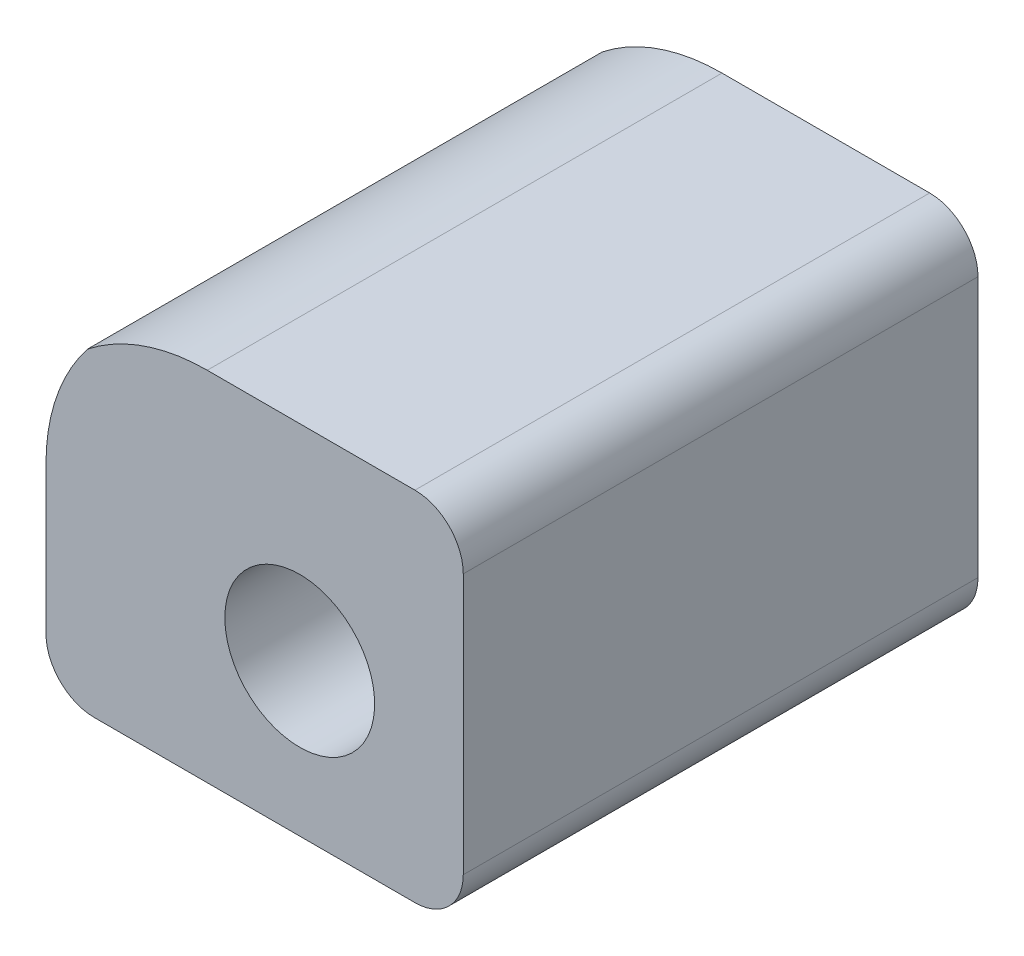
from build123d import *

# Parameters (mm, degrees)
SKETCH_1_R          = 1.531489915
EXTRUDE_1_DEPTH     = 1.68
SKETCH_1_R_2        = 1.063949022
EXTRUDE_1_2_DEPTH   = 1.68
SKETCH_1_R_3        = 2.489250022
EXTRUDE_1_3_DEPTH   = 1.68
SKETCH_1_W          = 72.86
SKETCH_1_H          = 61.86
SKETCH_1_R_4        = 1.55
EXTRUDE_1_4_DEPTH   = 1.68
SKETCH_2_R          = 3
SKETCH_2_R_2        = 1.55
EXTRUDE_3_DEPTH     = 2
SKETCH_3_W          = 72.86
SKETCH_3_H          = 61.86
SKETCH_3_W_2        = 69.50125591
SKETCH_3_H_2        = 58.5
EXTRUDE_4_DEPTH     = 15.85
SKETCH_4_W          = 17
SKETCH_4_H          = 15
CUT_EXTRUDE_1_DEPTH = 3.68
SKETCH_6_W          = 7.25
SKETCH_6_H          = 16
SKETCH_6_W_2        = 2.5
SKETCH_6_H_2        = 18
CUT_EXTRUDE_3_DEPTH = 7.8
SKETCH_7_W          = 10
SKETCH_7_H          = 4
SKETCH_7_W_2        = 17
SKETCH_7_H_2        = 8
SKETCH_7_W_3        = 8
SKETCH_7_H_3        = 13.300256909
CUT_EXTRUDE_5_DEPTH = 2
SKETCH_8_R          = 1.556852558
SKETCH_8_W          = 2.041099746
SKETCH_8_H          = 24.945353107
CUT_EXTRUDE_6_DEPTH = 2
FILLET_1_R          = 1.68
FILLET_2_R          = 2
FILLET_3_R          = 1.68
FILLET_4_R          = 2
FILLET_5_R          = 3
FILLET_6_R          = 1
FILLET_7_R          = 1
SKETCH_9_R          = 4
CUT_EXTRUDE_7_DEPTH = 0.8
SKETCH_10_W         = 44.758598589
SKETCH_10_H         = 6.5
SKETCH_10_W_2       = 44.448850503
CUT_EXTRUDE_8_DEPTH = 0.8
SKETCH_11_R         = 1.55
EXTRUDE_6_DEPTH     = 10.65
CUT_EXTRUDE_9_DEPTH = 62.6
FILLET_8_R          = 4
FILLET_9_R          = 1


with BuildPart() as part:
    # 草图1 → 凸台-拉伸1 (new body)
    with BuildSketch(Plane.XY):
        with Locations((1.504266973, 51.672660554)):
            Circle(SKETCH_1_R)
    extrude(amount=EXTRUDE_1_DEPTH)


with BuildPart() as body_2:
    # 草图1 → Extrude 1 2 (new body)
    with BuildSketch(Plane.XY):
        with Locations((-18.258772408, 61.840992468)):
            Circle(SKETCH_1_R_2)
    extrude(amount=EXTRUDE_1_2_DEPTH)


with BuildPart() as body_3:
    # 草图1 → Extrude 1 3 (new body)
    with BuildSketch(Plane.XY):
        with Locations((-18.258772408, -10.975845657)):
            Circle(SKETCH_1_R_3)
    extrude(amount=EXTRUDE_1_3_DEPTH)


with BuildPart() as body_4:
    # 草图1 → Extrude 1 4 (new body)
    with BuildSketch(Plane.XY):
        with Locations((-46.758772408, 26.672660554)):
            Rectangle(SKETCH_1_W, SKETCH_1_H)
        with Locations((-76.258772408, 51.672660554)):
            Circle(SKETCH_1_R_4, mode=Mode.SUBTRACT)
        with Locations((-18.258772408, 51.672660554)):
            Circle(SKETCH_1_R_4, mode=Mode.SUBTRACT)
        with Locations((-76.258772408, 2.672660554)):
            Circle(SKETCH_1_R_4, mode=Mode.SUBTRACT)
        with Locations((-18.258772408, 2.672660554)):
            Circle(SKETCH_1_R_4, mode=Mode.SUBTRACT)
    extrude(amount=EXTRUDE_1_4_DEPTH)

    # 草图2 → 凸台-拉伸3 (add)
    # profile 1 of 4: a face of its own
    with BuildSketch(Plane.XY.offset(1.68)):
        with Locations((-76.258772408, 2.672660554)):
            Circle(SKETCH_2_R)
        with Locations((-76.258772408, 2.672660554)):
            Circle(SKETCH_2_R_2, mode=Mode.SUBTRACT)
    # profile 2 of 4: a face of its own
    with BuildSketch(Plane.XY.offset(1.68)):
        with Locations((-18.258772408, 2.672660554)):
            Circle(SKETCH_2_R)
        with Locations((-18.258772408, 2.672660554)):
            Circle(SKETCH_2_R_2, mode=Mode.SUBTRACT)
    # profile 3 of 4: a face of its own
    with BuildSketch(Plane.XY.offset(1.68)):
        with Locations((-76.258772408, 51.672660554)):
            Circle(SKETCH_2_R)
        with Locations((-76.258772408, 51.672660554)):
            Circle(SKETCH_2_R_2, mode=Mode.SUBTRACT)
    # profile 4 of 4: a face of its own
    with BuildSketch(Plane.XY.offset(1.68)):
        with Locations((-18.258772408, 51.672660554)):
            Circle(SKETCH_2_R)
        with Locations((-18.258772408, 51.672660554)):
            Circle(SKETCH_2_R_2, mode=Mode.SUBTRACT)
    extrude(amount=EXTRUDE_3_DEPTH)

    # 草图3 → 凸台-拉伸4 (add)
    with BuildSketch(Plane.XY.offset(1.68)):
        with Locations((-46.758772408, 26.672660554)):
            Rectangle(SKETCH_3_W, SKETCH_3_H)
        with Locations((-46.758144453, 26.672660554)):
            Rectangle(SKETCH_3_W_2, SKETCH_3_H_2, mode=Mode.SUBTRACT)
    extrude(amount=EXTRUDE_4_DEPTH)

    # 草图4 → 切除-拉伸1 (cut)
    with BuildSketch(Plane(origin=(0, 0, 0), x_dir=(-1, 0, 0), z_dir=(0, 0, -1))):
        with Locations((74.688772408, 28.322197805)):
            Rectangle(SKETCH_4_W, SKETCH_4_H)
    extrude(amount=-CUT_EXTRUDE_1_DEPTH, mode=Mode.SUBTRACT)

    # 草图6 → 切除-拉伸3 (cut)
    with BuildSketch(Plane(origin=(-10.328772408, 0, 0), x_dir=(0, 0, -1), z_dir=(1, 0, 0))):
        with Locations((-8.625, 30.672660554)):
            Rectangle(SKETCH_6_W, SKETCH_6_H)
        with Locations((-14.975303343, 19.628822862)):
            Rectangle(SKETCH_6_W_2, SKETCH_6_H_2)
    extrude(amount=-CUT_EXTRUDE_3_DEPTH, mode=Mode.SUBTRACT)

    # 草图7 → 切除-拉伸5 (cut)
    with BuildSketch(Plane.XZ.offset(4.257339446)):
        with Locations((-69.258772408, 6.68)):
            Rectangle(SKETCH_7_W, SKETCH_7_H)
        with Locations((-47.758772408, 8.68)):
            Rectangle(SKETCH_7_W_2, SKETCH_7_H_2)
        with Locations((-26.258772408, 11.330128455)):
            Rectangle(SKETCH_7_W_3, SKETCH_7_H_3)
    extrude(amount=-CUT_EXTRUDE_5_DEPTH, mode=Mode.SUBTRACT)

    # 草图8 → 切除-拉伸6 (cut)
    with BuildSketch(Plane.ZY.offset(83.188772408)):
        with Locations((7.843859074, 9.687980695)):
            Circle(SKETCH_8_R)
        with Locations((7.730007332, 28.982792683)):
            Rectangle(SKETCH_8_W, SKETCH_8_H)
    extrude(amount=-CUT_EXTRUDE_6_DEPTH, mode=Mode.SUBTRACT)

    # 圆角1
    fillet_1_edges = [body_4.edges().sort_by_distance(p)[0] for p in [
        (-12.007516498, 55.922660554, 9.605),
        (-81.508772408, 55.922660554, 9.605),
        (-81.508772408, -2.577339446, 9.605),
        (-12.007516498, -2.577339446, 9.605),
        (-10.328772408, -4.257339446, 8.765),
        (-83.188772408, -4.257339446, 8.765),
        (-83.188772408, 57.602660554, 8.765),
        (-10.328772408, 57.602660554, 8.765),
    ]]
    fillet(fillet_1_edges, radius=FILLET_1_R)

    # 圆角2
    fillet_2_edges = [body_4.edges().sort_by_distance(p)[0] for p in [
        (-66.188772408, 20.822197805, 0.84),
        (-66.188772408, 35.822197805, 0.84),
    ]]
    fillet(fillet_2_edges, radius=FILLET_2_R)

    # 圆角3
    fillet_3_edges = [body_4.edges().sort_by_distance(p)[0] for p in [
        (-74.258772408, -3.417339446, 4.68),
        (-64.258772408, -3.417339446, 4.68),
    ]]
    fillet(fillet_3_edges, radius=FILLET_3_R)

    # 圆角4
    fillet_4_edges = [body_4.edges().sort_by_distance(p)[0] for p in [
        (-56.258772408, -3.417339446, 4.68),
        (-39.258772408, -3.417339446, 4.68),
    ]]
    fillet(fillet_4_edges, radius=FILLET_4_R)

    # 圆角5
    fillet_5_edges = [body_4.edges().sort_by_distance(p)[0] for p in [
        (-30.258772408, -3.417339446, 4.68),
        (-22.258772408, -3.417339446, 4.68),
    ]]
    fillet(fillet_5_edges, radius=FILLET_5_R)

    # 圆角6
    fillet_6_edges = [body_4.edges().sort_by_distance(p)[0] for p in [
        (-11.168144453, 10.628822862, 16.225303343),
        (-11.168144453, 28.628822862, 16.225303343),
        (-11.168144453, 28.628822862, 13.725303343),
        (-11.168144453, 10.628822862, 13.725303343),
    ]]
    fillet(fillet_6_edges, radius=FILLET_6_R)

    # 圆角7
    fillet_7_edges = [body_4.edges().sort_by_distance(p)[0] for p in [
        (-11.168144453, 38.672660554, 5),
        (-11.168144453, 22.672660554, 5),
        (-11.168144453, 22.672660554, 12.25),
        (-11.168144453, 38.672660554, 12.25),
        (-82.348772408, 16.510116129, 6.709457459),
        (-82.348772408, 41.455469236, 6.709457459),
        (-82.348772408, 41.455469236, 8.750557205),
        (-82.348772408, 16.510116129, 8.750557205),
        (-82.348772408, 20.822197805, 3.68),
        (-82.348772408, 35.822197805, 3.68),
    ]]
    fillet(fillet_7_edges, radius=FILLET_7_R)

    # 草图9 → 切除-拉伸7 (cut)
    with BuildSketch(Plane(origin=(0, 0, 0), x_dir=(-1, 0, 0), z_dir=(0, 0, -1))):
        with Locations((18.258772408, 51.672660554)):
            Circle(SKETCH_9_R)
        with Locations((76.258772408, 51.672660554)):
            Circle(SKETCH_9_R)
        with Locations((18.258772408, 2.672660554)):
            Circle(SKETCH_9_R)
        with Locations((76.258772408, 2.672660554)):
            Circle(SKETCH_9_R)
    extrude(amount=-CUT_EXTRUDE_7_DEPTH, mode=Mode.SUBTRACT)

    # 草图10 → 切除-拉伸8 (cut)
    with BuildSketch(Plane(origin=(0, 0, 0), x_dir=(-1, 0, 0), z_dir=(0, 0, -1))):
        with Locations((41.37196271, 38.672660554)):
            Rectangle(SKETCH_10_W, SKETCH_10_H)
        with Locations((41.37196271, 14.672660554)):
            Rectangle(SKETCH_10_W_2, SKETCH_10_H)
    extrude(amount=-CUT_EXTRUDE_8_DEPTH, mode=Mode.SUBTRACT)

    # 草图11 → 凸台-拉伸6 (add)
    # profile 1 of 2: a face of its own
    with BuildSketch(Plane.XY.offset(3.68)):
        Polygon((-79.828772408, 55.922660554), (-81.508772408, 54.242660554), (-81.508772408, 48.531036753), (-72.875228226, 48.531036753), (-72.875228226, 55.922660554), align=None)
        with Locations(Location((-76.258772408, 51.672660554, 0), (0, 0, 180))):
            Circle(SKETCH_11_R, mode=Mode.SUBTRACT)
    # profile 2 of 2: a face of its own
    with BuildSketch(Plane.XY.offset(3.68)):
        Polygon((-93.925658587, 53.936639744), (-95.605658587, 52.256639744), (-95.605658587, 46.545015943), (-86.972114405, 46.545015943), (-86.972114405, 53.936639744), align=None)
        with Locations(Location((-90.355658587, 49.686639744, 0), (0, 0, 180))):
            Circle(SKETCH_11_R, mode=Mode.SUBTRACT)
    extrude(amount=EXTRUDE_6_DEPTH)


with BuildPart() as extrude_6_piece_1:
    # of the separate pieces the step leaves, piece 1, a body of its own (extrude_6_pieces)
    add(body_4.part.solids().sort_by_distance((-10.328772408, 38.672660554, 6))[0])


with BuildPart() as extrude_6_piece_2:
    # of the separate pieces the step leaves, piece 2, a body of its own (extrude_6_pieces)
    add(body_4.part.solids().sort_by_distance((-93.925658587, 53.936639744, 3.68))[0])

    # 圆角8
    # the kernel refuses this fillet: 4 mm, written as the material it takes off along each edge
    with BuildSketch(Plane(origin=(-93.925658587, 53.936639744, -0.462135624), x_dir=(-0.7071067811865455, -0.7071067811865497, 0), z_dir=(0, 0, 1))) as fillet_8_piece_1:
        with BuildLine():
            CenterArc((FILLET_8_R * 0.414213562373, FILLET_8_R), FILLET_8_R, 225, 45)
            Line((-FILLET_8_R * 0.292893218813, FILLET_8_R * 0.292893218813), (0, 0))
            Line((0, 0), (FILLET_8_R * 0.414213562373, 0))
        make_face()
    extrude(amount=18.934271247, mode=Mode.SUBTRACT)
    with BuildSketch(Plane(origin=(-95.605658587, 52.256639744, -0.462135624), x_dir=(0.7071067811865411, 0.707106781186554, 0), z_dir=(0, 0, 1))) as fillet_8_piece_2:
        with BuildLine():
            CenterArc((FILLET_8_R * 0.414213562373, -FILLET_8_R), FILLET_8_R, 90, 45)
            Line((-FILLET_8_R * 0.292893218813, -FILLET_8_R * 0.292893218813), (0, 0))
            Line((0, 0), (FILLET_8_R * 0.414213562373, 0))
        make_face()
    extrude(amount=18.934271247, mode=Mode.SUBTRACT)

    # 圆角9
    fillet_9_edges = [extrude_6_piece_2.edges().sort_by_distance(p)[0] for p in [
        (-86.972114405, 53.936639744, 9.005),
        (-86.972114405, 46.545015943, 9.005),
        (-95.605658587, 46.545015943, 9.005),
    ]]
    fillet(fillet_9_edges, radius=FILLET_9_R)


with BuildPart() as cut_extrude_9_tool:
    # 草图13 → 切除-拉伸9 (new body)
    with BuildSketch(Plane.XY.offset(17.53)):
        Polygon((-85.534397359, 61.466506159), (-87.240895033, -11.116528255), (-1.802244806, -17.146153371), (14.580132867, 61.466506159), (-40.278079036, 71.546219088), align=None)
    extrude(amount=-CUT_EXTRUDE_9_DEPTH)


with BuildPart() as part_1:
    add(part.part)

    # 切除-拉伸9: cut by cut_extrude_9_tool
    add(cut_extrude_9_tool.part, mode=Mode.SUBTRACT)


with BuildPart() as body_2_1:
    add(body_2.part)

    # 切除-拉伸9: cut by cut_extrude_9_tool
    add(cut_extrude_9_tool.part, mode=Mode.SUBTRACT)


with BuildPart() as body_3_1:
    add(body_3.part)

    # 切除-拉伸9: cut by cut_extrude_9_tool
    add(cut_extrude_9_tool.part, mode=Mode.SUBTRACT)


with BuildPart() as extrude_6_piece_1_1:
    add(extrude_6_piece_1.part)

    # 切除-拉伸9: cut by cut_extrude_9_tool
    add(cut_extrude_9_tool.part, mode=Mode.SUBTRACT)


solid = extrude_6_piece_2.part
